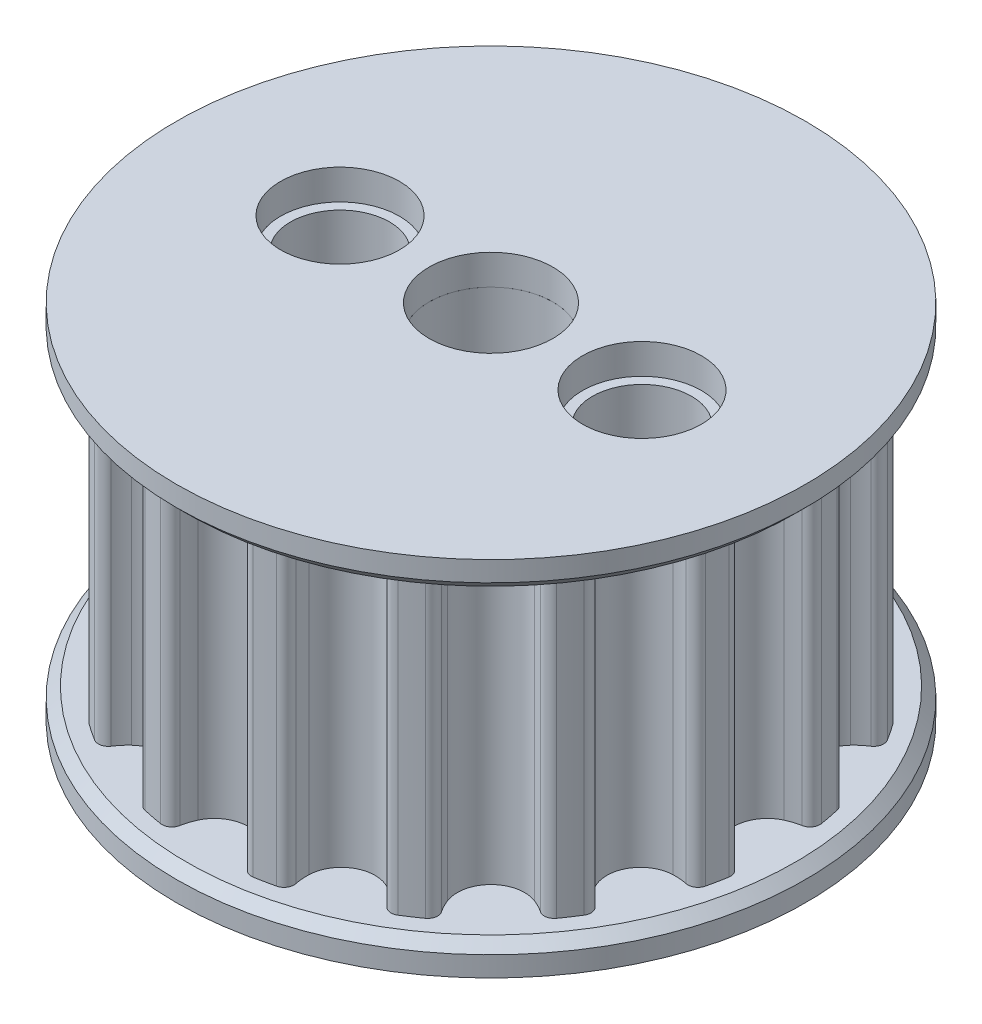
from build123d import *

# Parameters (mm, degrees)
SKETCH1_R           = 1.5625
BOSS_EXTRUDE1_DEPTH = 3.81
SKETCH2_R           = 7.9375
SKETCH2_R_2         = 1.5625
BOSS_EXTRUDE2_DEPTH = 0.762
SKETCH3_R           = 1.5
CUT_EXTRUDE1_DEPTH  = 15.009487375
SKETCH4_R           = 1.25
CUT_EXTRUDE2_DEPTH  = 14.567321493
CHAMFER1_SIZE       = 0.254


with BuildPart() as part:
    # Sketch1 → Boss-Extrude1 (new, symmetric)
    with BuildSketch(Plane(origin=(0, 0, 0), x_dir=(1, 0, 0), z_dir=(0, 1, 0))):
        with BuildLine():
            ThreePointArc((-1.850768, -6.777037356), (-1.816941892, -6.962421006), (-1.663291889, -7.071521784))
            ThreePointArc((-1.663291889, -7.071521784), (-1.417233644, -7.124914669), (-1.169472895, -7.169748489))
            ThreePointArc((-1.169472895, -7.169748489), (-0.985767742, -7.127751824), (-0.883573242, -6.969424355))
            ThreePointArc((-0.883573242, -6.969424355), (-0.839120956, -6.792881518), (-0.773880597, -6.622919538))
            ThreePointArc((-0.773880597, -6.622919538), (0, -6.1245), (0.773880597, -6.622919538))
            ThreePointArc((0.773880597, -6.622919538), (0.839120956, -6.792881518), (0.883573242, -6.969424355))
            ThreePointArc((0.883573242, -6.969424355), (0.985767742, -7.127751824), (1.169472895, -7.169748489))
            ThreePointArc((1.169472895, -7.169748489), (1.417233644, -7.124914669), (1.663291889, -7.071521784))
            ThreePointArc((1.663291889, -7.071521784), (1.816941892, -6.962421006), (1.850768, -6.777037356))
            ThreePointArc((1.850768, -6.777037356), (1.824276538, -6.596921889), (1.819509137, -6.414931089))
            ThreePointArc((1.819509137, -6.414931089), (2.343744682, -5.658300197), (3.249454025, -5.822628523))
            ThreePointArc((3.249454025, -5.822628523), (3.374769892, -5.954686513), (3.483398468, -6.100779674))
            ThreePointArc((3.483398468, -6.100779674), (3.638403174, -6.20794704), (3.824196033, -6.176445981))
            ThreePointArc((3.824196033, -6.176445981), (4.035939958, -6.040210999), (4.242835561, -5.896719991))
            ThreePointArc((4.242835561, -5.896719991), (4.343038594, -5.737124705), (4.303346591, -5.552907854))
            ThreePointArc((4.303346591, -5.552907854), (4.209944466, -5.396640704), (4.135895098, -5.230327534))
            ThreePointArc((4.135895098, -5.230327534), (4.330675481, -4.330675481), (5.230327534, -4.135895098))
            ThreePointArc((5.230327534, -4.135895098), (5.396640704, -4.209944466), (5.552907854, -4.303346591))
            ThreePointArc((5.552907854, -4.303346591), (5.737124705, -4.343038594), (5.896719991, -4.242835561))
            ThreePointArc((5.896719991, -4.242835561), (6.040210999, -4.035939958), (6.176445981, -3.824196033))
            ThreePointArc((6.176445981, -3.824196033), (6.20794704, -3.638403174), (6.100779674, -3.483398468))
            ThreePointArc((6.100779674, -3.483398468), (5.954686513, -3.374769892), (5.822628523, -3.249454025))
            ThreePointArc((5.822628523, -3.249454025), (5.658300197, -2.343744682), (6.414931089, -1.819509137))
            ThreePointArc((6.414931089, -1.819509137), (6.596921889, -1.824276538), (6.777037356, -1.850768))
            ThreePointArc((6.777037356, -1.850768), (6.962421006, -1.816941892), (7.071521784, -1.663291889))
            ThreePointArc((7.071521784, -1.663291889), (7.124914669, -1.417233644), (7.169748489, -1.169472895))
            ThreePointArc((7.169748489, -1.169472895), (7.127751824, -0.985767742), (6.969424355, -0.883573242))
            ThreePointArc((6.969424355, -0.883573242), (6.792881518, -0.839120956), (6.622919538, -0.773880597))
            ThreePointArc((6.622919538, -0.773880597), (6.1245, 0), (6.622919538, 0.773880597))
            ThreePointArc((6.622919538, 0.773880597), (6.792881518, 0.839120956), (6.969424355, 0.883573242))
            ThreePointArc((6.969424355, 0.883573242), (7.127751824, 0.985767742), (7.169748489, 1.169472895))
            ThreePointArc((7.169748489, 1.169472895), (7.124914669, 1.417233644), (7.071521784, 1.663291889))
            ThreePointArc((7.071521784, 1.663291889), (6.962421006, 1.816941892), (6.777037356, 1.850768))
            ThreePointArc((6.777037356, 1.850768), (6.596921889, 1.824276538), (6.414931089, 1.819509137))
            ThreePointArc((6.414931089, 1.819509137), (5.658300197, 2.343744682), (5.822628523, 3.249454025))
            ThreePointArc((5.822628523, 3.249454025), (5.954686513, 3.374769892), (6.100779674, 3.483398468))
            ThreePointArc((6.100779674, 3.483398468), (6.20794704, 3.638403174), (6.176445981, 3.824196033))
            ThreePointArc((6.176445981, 3.824196033), (6.040210999, 4.035939958), (5.896719991, 4.242835561))
            ThreePointArc((5.896719991, 4.242835561), (5.737124705, 4.343038594), (5.552907854, 4.303346591))
            ThreePointArc((5.552907854, 4.303346591), (5.396640704, 4.209944466), (5.230327534, 4.135895098))
            ThreePointArc((5.230327534, 4.135895098), (4.330675481, 4.330675481), (4.135895098, 5.230327534))
            ThreePointArc((4.135895098, 5.230327534), (4.209944466, 5.396640704), (4.303346591, 5.552907854))
            ThreePointArc((4.303346591, 5.552907854), (4.343038594, 5.737124705), (4.242835561, 5.896719991))
            ThreePointArc((4.242835561, 5.896719991), (4.035939958, 6.040210999), (3.824196033, 6.176445981))
            ThreePointArc((3.824196033, 6.176445981), (3.638403174, 6.20794704), (3.483398468, 6.100779674))
            ThreePointArc((3.483398468, 6.100779674), (3.374769892, 5.954686513), (3.249454025, 5.822628523))
            ThreePointArc((3.249454025, 5.822628523), (2.343744682, 5.658300197), (1.819509137, 6.414931089))
            ThreePointArc((1.819509137, 6.414931089), (1.824276538, 6.596921889), (1.850768, 6.777037356))
            ThreePointArc((1.850768, 6.777037356), (1.816941892, 6.962421006), (1.663291889, 7.071521784))
            ThreePointArc((1.663291889, 7.071521784), (1.417233644, 7.124914669), (1.169472895, 7.169748489))
            ThreePointArc((1.169472895, 7.169748489), (0.985767742, 7.127751824), (0.883573242, 6.969424355))
            ThreePointArc((0.883573242, 6.969424355), (0.839120956, 6.792881518), (0.773880597, 6.622919538))
            ThreePointArc((0.773880597, 6.622919538), (0, 6.1245), (-0.773880597, 6.622919538))
            ThreePointArc((-0.773880597, 6.622919538), (-0.839120956, 6.792881518), (-0.883573242, 6.969424355))
            ThreePointArc((-0.883573242, 6.969424355), (-0.985767742, 7.127751824), (-1.169472895, 7.169748489))
            ThreePointArc((-1.169472895, 7.169748489), (-1.417233644, 7.124914669), (-1.663291889, 7.071521784))
            ThreePointArc((-1.663291889, 7.071521784), (-1.816941892, 6.962421006), (-1.850768, 6.777037356))
            ThreePointArc((-1.850768, 6.777037356), (-1.824276538, 6.596921889), (-1.819509137, 6.414931089))
            ThreePointArc((-1.819509137, 6.414931089), (-2.343744682, 5.658300197), (-3.249454025, 5.822628523))
            ThreePointArc((-3.249454025, 5.822628523), (-3.374769892, 5.954686513), (-3.483398468, 6.100779674))
            ThreePointArc((-3.483398468, 6.100779674), (-3.638403174, 6.20794704), (-3.824196033, 6.176445981))
            ThreePointArc((-3.824196033, 6.176445981), (-4.035939958, 6.040210999), (-4.242835561, 5.896719991))
            ThreePointArc((-4.242835561, 5.896719991), (-4.343038594, 5.737124705), (-4.303346591, 5.552907854))
            ThreePointArc((-4.303346591, 5.552907854), (-4.209944466, 5.396640704), (-4.135895098, 5.230327534))
            ThreePointArc((-4.135895098, 5.230327534), (-4.330675481, 4.330675481), (-5.230327534, 4.135895098))
            ThreePointArc((-5.230327534, 4.135895098), (-5.396640704, 4.209944466), (-5.552907854, 4.303346591))
            ThreePointArc((-5.552907854, 4.303346591), (-5.737124705, 4.343038594), (-5.896719991, 4.242835561))
            ThreePointArc((-5.896719991, 4.242835561), (-6.040210999, 4.035939958), (-6.176445981, 3.824196033))
            ThreePointArc((-6.176445981, 3.824196033), (-6.20794704, 3.638403174), (-6.100779674, 3.483398468))
            ThreePointArc((-6.100779674, 3.483398468), (-5.954686513, 3.374769892), (-5.822628523, 3.249454025))
            ThreePointArc((-5.822628523, 3.249454025), (-5.658300197, 2.343744682), (-6.414931089, 1.819509137))
            ThreePointArc((-6.414931089, 1.819509137), (-6.596921889, 1.824276538), (-6.777037356, 1.850768))
            ThreePointArc((-6.777037356, 1.850768), (-6.962421006, 1.816941892), (-7.071521784, 1.663291889))
            ThreePointArc((-7.071521784, 1.663291889), (-7.124914669, 1.417233644), (-7.169748489, 1.169472895))
            ThreePointArc((-7.169748489, 1.169472895), (-7.127751824, 0.985767742), (-6.969424355, 0.883573242))
            ThreePointArc((-6.969424355, 0.883573242), (-6.792881518, 0.839120956), (-6.622919538, 0.773880597))
            ThreePointArc((-6.622919538, 0.773880597), (-6.1245, 0), (-6.622919538, -0.773880597))
            ThreePointArc((-6.622919538, -0.773880597), (-6.792881518, -0.839120956), (-6.969424355, -0.883573242))
            ThreePointArc((-6.969424355, -0.883573242), (-7.127751824, -0.985767742), (-7.169748489, -1.169472895))
            ThreePointArc((-7.169748489, -1.169472895), (-7.124914669, -1.417233644), (-7.071521784, -1.663291889))
            ThreePointArc((-7.071521784, -1.663291889), (-6.962421006, -1.816941892), (-6.777037356, -1.850768))
            ThreePointArc((-6.777037356, -1.850768), (-6.596921889, -1.824276538), (-6.414931089, -1.819509137))
            ThreePointArc((-6.414931089, -1.819509137), (-5.658300197, -2.343744682), (-5.822628523, -3.249454025))
            ThreePointArc((-5.822628523, -3.249454025), (-5.954686513, -3.374769892), (-6.100779674, -3.483398468))
            ThreePointArc((-6.100779674, -3.483398468), (-6.20794704, -3.638403174), (-6.176445981, -3.824196033))
            ThreePointArc((-6.176445981, -3.824196033), (-6.040210999, -4.035939958), (-5.896719991, -4.242835561))
            ThreePointArc((-5.896719991, -4.242835561), (-5.737124705, -4.343038594), (-5.552907854, -4.303346591))
            ThreePointArc((-5.552907854, -4.303346591), (-5.396640704, -4.209944466), (-5.230327534, -4.135895098))
            ThreePointArc((-5.230327534, -4.135895098), (-4.330675481, -4.330675481), (-4.135895098, -5.230327534))
            ThreePointArc((-4.135895098, -5.230327534), (-4.209944466, -5.396640704), (-4.303346591, -5.552907854))
            ThreePointArc((-4.303346591, -5.552907854), (-4.343038594, -5.737124705), (-4.242835561, -5.896719991))
            ThreePointArc((-4.242835561, -5.896719991), (-4.035939958, -6.040210999), (-3.824196033, -6.176445981))
            ThreePointArc((-3.824196033, -6.176445981), (-3.638403174, -6.20794704), (-3.483398468, -6.100779674))
            ThreePointArc((-3.483398468, -6.100779674), (-3.374769892, -5.954686513), (-3.249454025, -5.822628523))
            ThreePointArc((-3.249454025, -5.822628523), (-2.343744682, -5.658300197), (-1.819509137, -6.414931089))
            ThreePointArc((-1.819509137, -6.414931089), (-1.824276538, -6.596921889), (-1.850768, -6.777037356))
        make_face()
        Circle(SKETCH1_R, mode=Mode.SUBTRACT)
    extrude(amount=BOSS_EXTRUDE1_DEPTH, both=True)

    # Sketch4 → Cut-Extrude2 (cut, through all)
    with BuildSketch(Plane.XZ.offset(3.81)):
        with Locations((-3.81, 0)):
            Circle(SKETCH4_R)
        with Locations((3.81, 0)):
            Circle(SKETCH4_R)
    extrude(amount=-CUT_EXTRUDE2_DEPTH, mode=Mode.SUBTRACT)


with BuildPart() as body_2:
    # Sketch2 → Boss-Extrude2 (new body)
    with BuildSketch(Plane.XZ.offset(3.81)):
        Circle(SKETCH2_R)
        Circle(SKETCH2_R_2, mode=Mode.SUBTRACT)
    extrude(amount=BOSS_EXTRUDE2_DEPTH)

    # Sketch3 → Cut-Extrude1 (cut, through all)
    with BuildSketch(Plane.XZ.offset(4.572)):
        with Locations((-3.81, 0)):
            Circle(SKETCH3_R)
        with Locations((3.81, 0)):
            Circle(SKETCH3_R)
    extrude(amount=-CUT_EXTRUDE1_DEPTH, mode=Mode.SUBTRACT)

    # Chamfer1
    chamfer1_edges = [body_2.edges().sort_by_distance(p)[0] for p in [
        (-7.9375, -3.81, 0),
    ]]
    chamfer(chamfer1_edges, length=CHAMFER1_SIZE)


with BuildPart() as body_3:
    # Mirror2: mirrored copy
    add(body_2.part.mirror(Plane.ZX))


solid = Compound([part.part, body_2.part, body_3.part])
